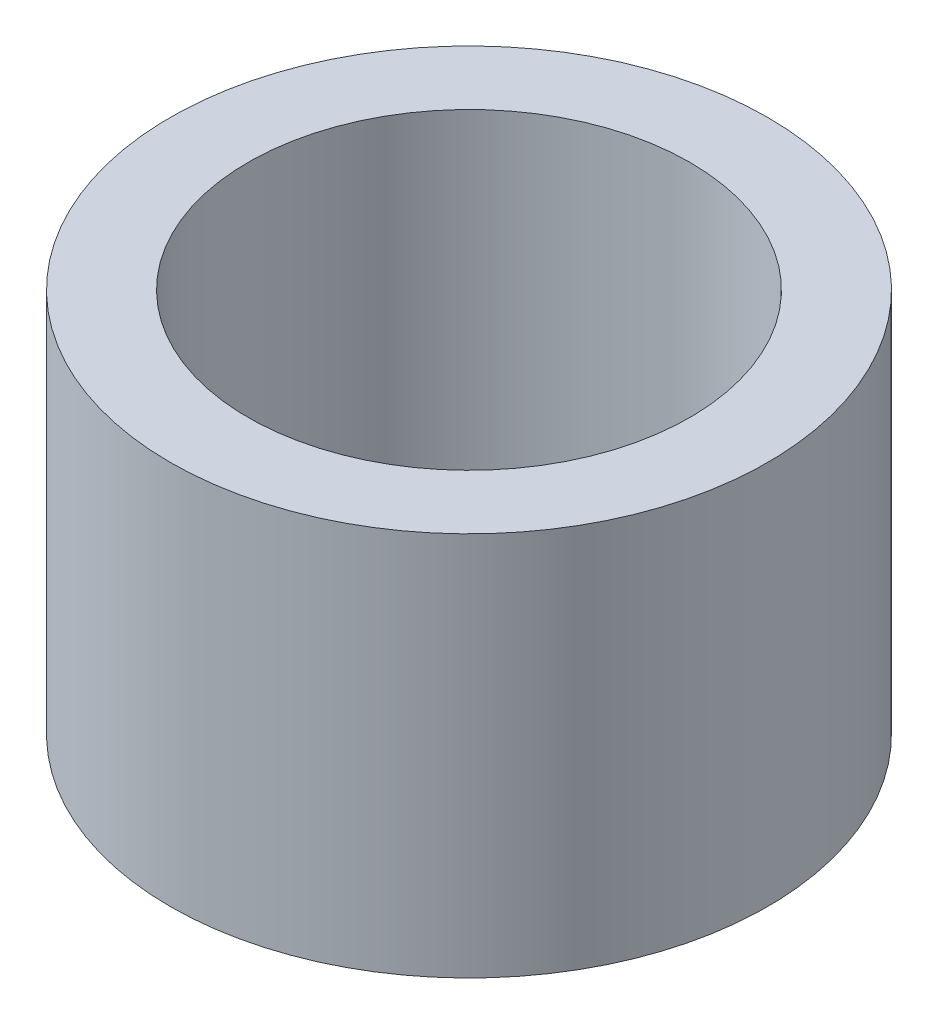
from build123d import *

# Parameters (mm, degrees)
SKETCH1_R           = 22.5
BOSS_EXTRUDE1_DEPTH = 28.970151586
SKETCH2_R           = 16.640560911
CUT_EXTRUDE1_DEPTH  = 44.032193564


with BuildPart() as part:
    # Sketch1 → Boss-Extrude1 (new body)
    with BuildSketch(Plane(origin=(0, 0, 0), x_dir=(1, 0, 0), z_dir=(0, 1, 0))):
        Circle(SKETCH1_R)
    extrude(amount=BOSS_EXTRUDE1_DEPTH)

    # Sketch2 → Cut-Extrude1 (cut, through all)
    with BuildSketch(Plane(origin=(0, 0, 0), x_dir=(1, 0, 0), z_dir=(0, 1, 0))):
        Circle(SKETCH2_R)
    extrude(amount=CUT_EXTRUDE1_DEPTH, mode=Mode.SUBTRACT)


solid = part.part
